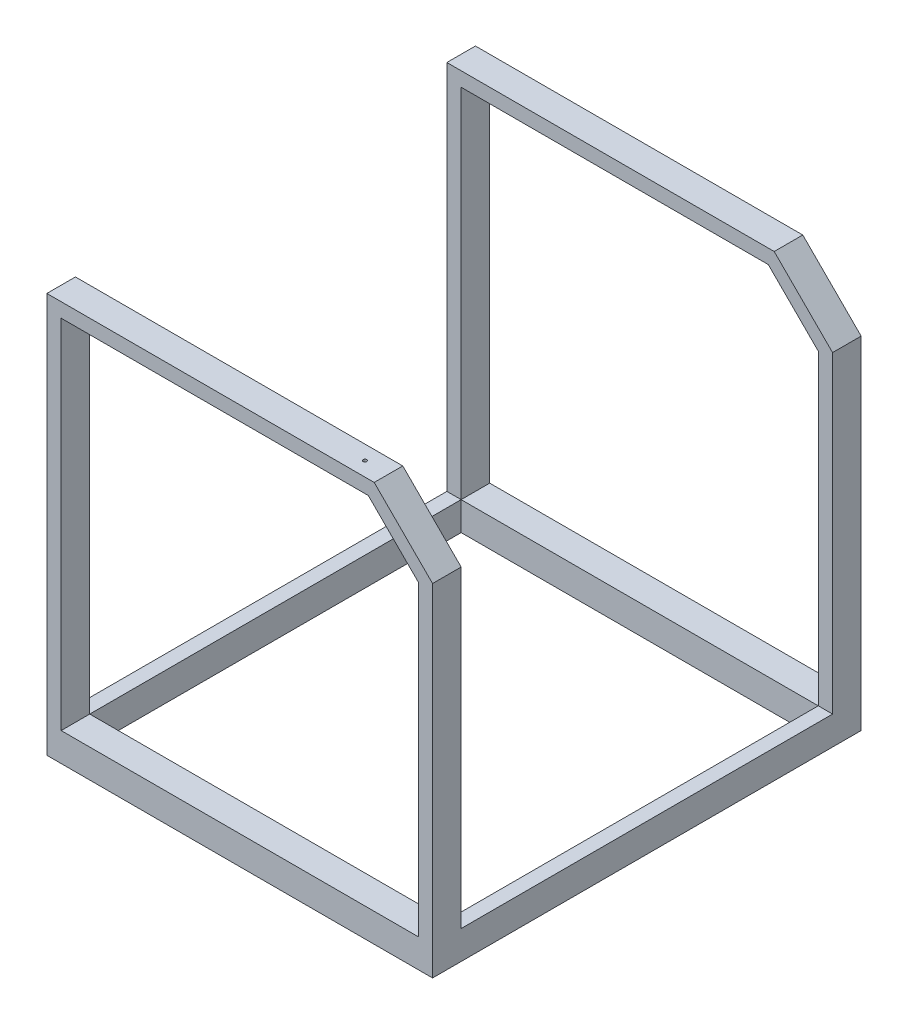
from build123d import *

# Parameters (mm, degrees)
BOSS_EXTRUDE1_DEPTH = 40
SKETCH2_W           = 20
SKETCH2_H           = 40
BOSS_EXTRUDE2_DEPTH = 520
SKETCH3_R           = 2.5
CUT_EXTRUDE1_DEPTH  = 61


with BuildPart() as part:
    # Sketch1 → Boss-Extrude1 (new body)
    with BuildSketch(Plane.XY):
        Polygon((0, 0), (0, 560), (458.284271247, 560), (540, 478.284271247), (540, 0), align=None)
        Polygon((20, 40), (20, 540), (450, 540), (520, 470), (520, 40), align=None, mode=Mode.SUBTRACT)
    boss_extrude1 = extrude(amount=BOSS_EXTRUDE1_DEPTH)

    # Sketch2 → Boss-Extrude2 (add)
    with BuildSketch(Plane.XY.offset(40)):
        with Locations((530, 20)):
            Rectangle(SKETCH2_W, SKETCH2_H)
        with Locations((10, 20)):
            Rectangle(SKETCH2_W, SKETCH2_H)
    extrude(amount=BOSS_EXTRUDE2_DEPTH)

    # Mirror1: Boss-Extrude1 across plane
    add(boss_extrude1.mirror(Plane(origin=(0, 0, 300), x_dir=(1, 0, 0), z_dir=(0, 0, -1))))

    # Sketch3 → Cut-Extrude1 (cut)
    with BuildSketch(Plane(origin=(0, 560, 0), x_dir=(1, 0, 0), z_dir=(0, 1, 0))):
        with Locations((425.284271247, -580)):
            Circle(SKETCH3_R)
    extrude(amount=-CUT_EXTRUDE1_DEPTH, mode=Mode.SUBTRACT)


solid = part.part
